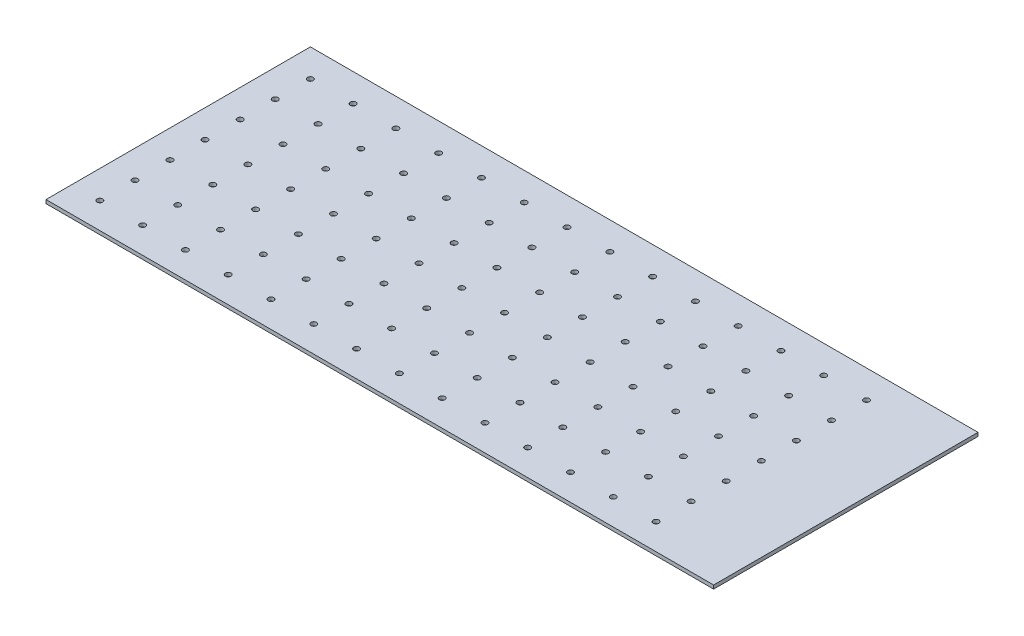
from build123d import *

# Parameters (mm, degrees)
SKETCH1_W            = 540
SKETCH1_H            = 233.64
BOSS_EXTRUDE1_DEPTH  = 3.18
CUT_EXTRUDE1_REACH   = 296.206
SKETCH2_R            = 2.5
LPATTERN1_COUNT      = 14
LPATTERN1_PITCH      = 37.81
LPATTERN1_COUNT_DIR2 = 7
LPATTERN1_PITCH_DIR2 = 31
SKETCH3_W            = 233.64
SKETCH3_H            = 3.18
BOSS_EXTRUDE2_DEPTH  = 50


with BuildPart() as part:
    # Sketch1 → Boss-Extrude1 (new body)
    with BuildSketch(Plane(origin=(0, 0, 0), x_dir=(1, 0, 0), z_dir=(0, 1, 0))):
        Rectangle(SKETCH1_W, SKETCH1_H)
    extrude(amount=BOSS_EXTRUDE1_DEPTH)

    # Sketch2 → Cut-Extrude1 (cut, up to next)
    with BuildSketch(Plane(origin=(0, 3.18, 0), x_dir=(1, 0, 0), z_dir=(0, 1, 0)), mode=Mode.PRIVATE) as cut_extrude1_sk1:
        with Locations((-245.45, 92.22)):
            Circle(SKETCH2_R)
    cut_extrude1_tool1 = extrude(cut_extrude1_sk1.sketch, amount=-CUT_EXTRUDE1_REACH, mode=Mode.PRIVATE) & part.part
    cut_extrude1 = cut_extrude1_tool1.solids().sort_by_distance((-245.45, 3.18, -92.22))[0]
    add(cut_extrude1, mode=Mode.SUBTRACT)

    # LPattern1: Cut-Extrude1 14 × 7
    with Locations(*[(i * LPATTERN1_PITCH, 0, j * LPATTERN1_PITCH_DIR2) for i in range(LPATTERN1_COUNT) for j in range(LPATTERN1_COUNT_DIR2) if (i, j) != (0, 0)]):
        add(cut_extrude1, mode=Mode.SUBTRACT)

    # Sketch3 → Boss-Extrude2 (add)
    with BuildSketch(Plane(origin=(270, 0, 0), x_dir=(0, 0, -1), z_dir=(1, 0, 0))):
        with Locations((0, 1.59)):
            Rectangle(SKETCH3_W, SKETCH3_H)
    extrude(amount=BOSS_EXTRUDE2_DEPTH)


solid = part.part
